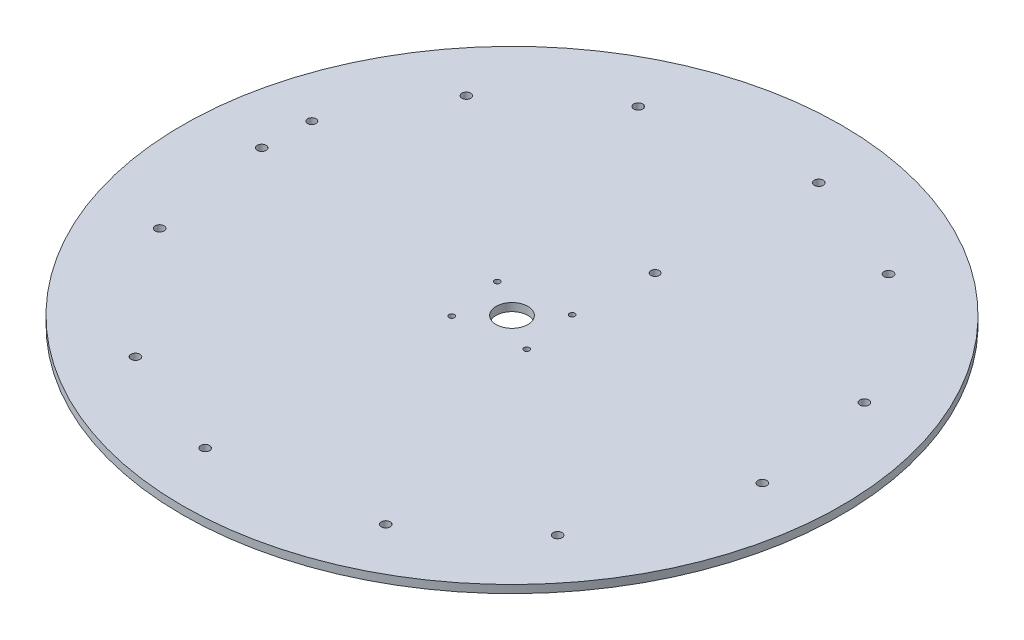
from build123d import *

# Parameters (mm, degrees)
SKETCH2_R               = 125
BOSS_EXTRUDE1_DEPTH     = 3
CUT_EXTRUDE1_START      = -26
SKETCH3_R               = 1.7
CUT_EXTRUDE1_DEPTH      = 88
CUT_EXTRUDE2_DEPTH      = 55
CUT_EXTRUDE2_DEPTH_BACK = 33
SKETCH4_R               = 6
SKETCH5_R               = 1.6
CUT_EXTRUDE3_DEPTH      = 177.802149308
CUT_EXTRUDE4_REACH      = 178.802
SKETCH6_R               = 1.05
CIRPATTERN1_COUNT       = 6


with BuildPart() as part:
    # Sketch2 → Boss-Extrude1 (new body)
    with BuildSketch(Plane(origin=(0, 0, 0), x_dir=(1, 0, 0), z_dir=(0, 1, 0))):
        Circle(SKETCH2_R)
    extrude(amount=BOSS_EXTRUDE1_DEPTH)

    # Sketch3 → Cut-Extrude1 (cut)
    with BuildSketch(Plane(origin=(0, 3, 0), x_dir=(1, 0, 0), z_dir=(0, 1, 0)).offset(CUT_EXTRUDE1_START)):
        with Locations((57.824361976, 84.994428132)):
            Circle(SKETCH3_R)
        with Locations((14.606066285, 101.75643704)):
            Circle(SKETCH3_R)
        with Locations((44.695152955, -92.574580495)):
            Circle(SKETCH3_R)
        with Locations((80.820626333, -63.527442972)):
            Circle(SKETCH3_R)
        with Locations((-102.519514931, 7.580152362)):
            Circle(SKETCH3_R)
        with Locations((-95.426692618, -38.228994068)):
            Circle(SKETCH3_R)
    cut_extrude1 = extrude(amount=CUT_EXTRUDE1_DEPTH, mode=Mode.SUBTRACT)

    # Sketch4 → Cut-Extrude2 (cut, two sides: drawn at the far end of the back side and taken through both)
    with BuildSketch(Plane(origin=(0, 3, 0), x_dir=(1, 0, 0), z_dir=(0, 1, 0)).offset(-CUT_EXTRUDE2_DEPTH_BACK)):
        Circle(SKETCH4_R)
    extrude(amount=CUT_EXTRUDE2_DEPTH + CUT_EXTRUDE2_DEPTH_BACK, mode=Mode.SUBTRACT)

    # Sketch5 → Cut-Extrude3 (cut, through all)
    with BuildSketch(Plane.XZ):
        with Locations((-101.778099897, -25.854755487)):
            Circle(SKETCH5_R)
        with Locations((13.216774043, -41.092175458)):
            Circle(SKETCH5_R)
    extrude(amount=-CUT_EXTRUDE3_DEPTH, mode=Mode.SUBTRACT)

    # Sketch6 → Cut-Extrude4 (cut, up to next)
    with BuildSketch(Plane(origin=(0, 3, 0), x_dir=(1, 0, 0), z_dir=(0, 1, 0)), mode=Mode.PRIVATE) as cut_extrude4_sk1:
        with Locations((11.198414604, 11.625148557)):
            Circle(SKETCH6_R)
    cut_extrude4_tool1 = extrude(cut_extrude4_sk1.sketch, amount=-CUT_EXTRUDE4_REACH, mode=Mode.PRIVATE) & part.part
    # Sketch6 → Cut-Extrude4 (cut, up to next)
    with BuildSketch(Plane(origin=(0, 3, 0), x_dir=(1, 0, 0), z_dir=(0, 1, 0)), mode=Mode.PRIVATE) as cut_extrude4_sk2:
        with Locations((13.889158795, -8.300914364)):
            Circle(SKETCH6_R)
    cut_extrude4_tool2 = extrude(cut_extrude4_sk2.sketch, amount=-CUT_EXTRUDE4_REACH, mode=Mode.PRIVATE) & part.part
    # Sketch6 → Cut-Extrude4 (cut, up to next)
    with BuildSketch(Plane(origin=(0, 3, 0), x_dir=(1, 0, 0), z_dir=(0, 1, 0)), mode=Mode.PRIVATE) as cut_extrude4_sk3:
        with Locations((-11.198414604, -11.625148557)):
            Circle(SKETCH6_R)
    cut_extrude4_tool3 = extrude(cut_extrude4_sk3.sketch, amount=-CUT_EXTRUDE4_REACH, mode=Mode.PRIVATE) & part.part
    # Sketch6 → Cut-Extrude4 (cut, up to next)
    with BuildSketch(Plane(origin=(0, 3, 0), x_dir=(1, 0, 0), z_dir=(0, 1, 0)), mode=Mode.PRIVATE) as cut_extrude4_sk4:
        with Locations((-13.889158795, 8.300914364)):
            Circle(SKETCH6_R)
    cut_extrude4_tool4 = extrude(cut_extrude4_sk4.sketch, amount=-CUT_EXTRUDE4_REACH, mode=Mode.PRIVATE) & part.part
    add(cut_extrude4_tool1.solids().sort_by_distance((11.198415, 3, -11.625149))[0], mode=Mode.SUBTRACT)
    add(cut_extrude4_tool2.solids().sort_by_distance((13.889159, 3, 8.300914))[0], mode=Mode.SUBTRACT)
    add(cut_extrude4_tool3.solids().sort_by_distance((-11.198415, 3, 11.625149))[0], mode=Mode.SUBTRACT)
    add(cut_extrude4_tool4.solids().sort_by_distance((-13.889159, 3, -8.300914))[0], mode=Mode.SUBTRACT)

    # CirPattern1: Cut-Extrude1 ×6 about axis
    cirpattern1_axis = Axis((0, 3, 0), (0, 1, 0))
    for i in range(1, CIRPATTERN1_COUNT):
        add(cut_extrude1.rotate(cirpattern1_axis, i * 360 / CIRPATTERN1_COUNT), mode=Mode.SUBTRACT)


solid = part.part
